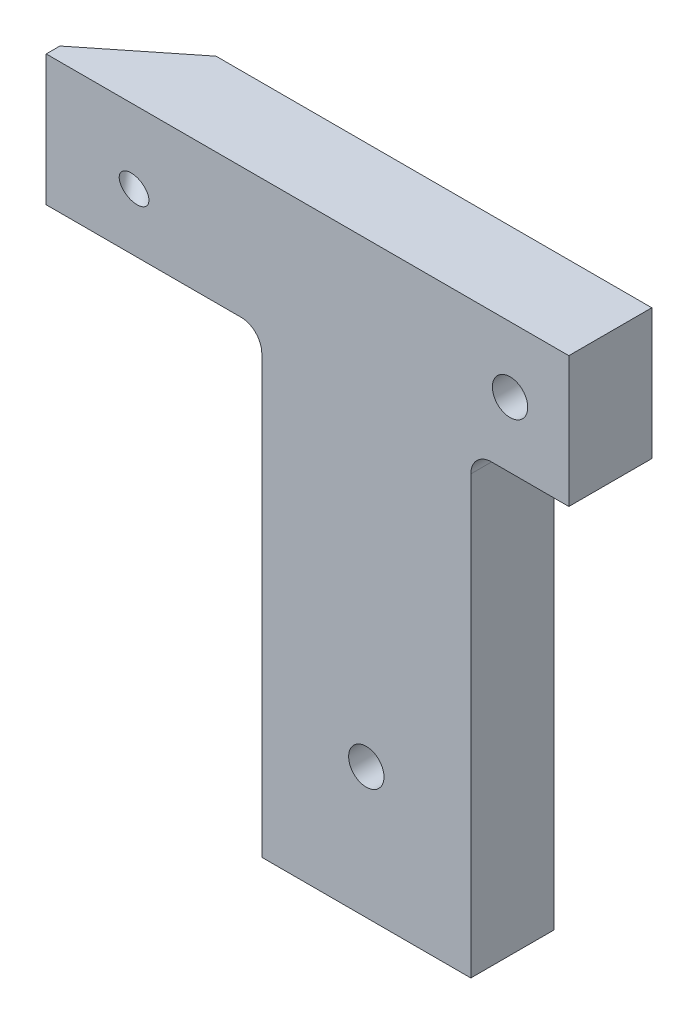
from build123d import *

# Parameters (mm, degrees)
SKETCH1_W                                      = 40
SKETCH1_H                                      = 45
BOSS_EXTRUDE1_DEPTH                            = 6.35
SKETCH4_W                                      = 20
SKETCH4_H                                      = 20
CUT_EXTRUDE1_DEPTH                             = 4
CUT_EXTRUDE2_DEPTH                             = 19
F_2_56_TAPPED_HOLE1_D                          = 1.778
CBORE_FOR_2_SOCKET_HEAD_CAP_SCREW1_D           = 2.7051
CBORE_FOR_2_SOCKET_HEAD_CAP_SCREW1_CBORE_D     = 4.7625
CBORE_FOR_2_SOCKET_HEAD_CAP_SCREW1_CBORE_DEPTH = 3.684397


with BuildPart() as part:
    # Sketch1 → Boss-Extrude1 (new body)
    with BuildSketch(Plane.XY):
        with Locations((20, 22.5)):
            Rectangle(SKETCH1_W, SKETCH1_H)
    extrude(amount=BOSS_EXTRUDE1_DEPTH)

    # Sketch4 → Cut-Extrude1 (cut)
    with BuildSketch(Plane(origin=(-7.105440946, 3.099734639, -8.910242022), x_dir=(-0.7987821683376376, -0.19767427710045044, 0.5682182043182321), z_dir=(-0.6016203516719011, 0.2624556952704026, -0.7544335361543175))):
        with Locations((-8.89534247, 42.50158613)):
            Rectangle(SKETCH4_W, SKETCH4_H)
    extrude(amount=-CUT_EXTRUDE1_DEPTH, mode=Mode.SUBTRACT)

    # Sketch7 → Cut-Extrude2 (cut)
    with BuildSketch(Plane(origin=(0, 0, 0), x_dir=(-1, 0, 0), z_dir=(0, 0, -1))):
        with BuildLine():
            Line((0, 0), (-16.5, 0))
            Line((-16.5, 0), (-16.5, 33.4125))
            ThreePointArc((-16.5, 33.4125), (-16.035032015, 34.535032015), (-14.9125, 35))
            Line((-14.9125, 35), (0, 35))
            Line((0, 35), (0, 0))
        make_face()
        with BuildLine():
            Line((-40, 0), (-32.5, 0))
            Line((-32.5, 0), (-32.5, 33.4125))
            ThreePointArc((-32.5, 33.4125), (-32.964967985, 34.535032015), (-34.0875, 35))
            Line((-34.0875, 35), (-40, 35))
            Line((-40, 35), (-40, 0))
        make_face()
    extrude(amount=-CUT_EXTRUDE2_DEPTH, mode=Mode.SUBTRACT)

    # #2-56 Tapped Hole1 (through all)
    with Locations(Plane(origin=(-4.698959539, 2.049911858, -5.892507877), x_dir=(-0.7987821683376376, -0.19767427710045052, 0.5682182043182324), z_dir=(-0.6016203516719012, 0.26245569527040247, -0.7544335361543173))):
        with Locations((-9.55561749, 39.318324151)):
            Hole(F_2_56_TAPPED_HOLE1_D / 2)

    # CBORE for #2 Socket Head Cap Screw1 (through all)
    with Locations(Plane(origin=(0, 0, 0), x_dir=(-1, 0, 0), z_dir=(0, 0, -1))):
        with Locations((-24.5, 10), (-35.5, 40)):
            CounterBoreHole(CBORE_FOR_2_SOCKET_HEAD_CAP_SCREW1_D / 2, CBORE_FOR_2_SOCKET_HEAD_CAP_SCREW1_CBORE_D / 2, CBORE_FOR_2_SOCKET_HEAD_CAP_SCREW1_CBORE_DEPTH)


solid = part.part
